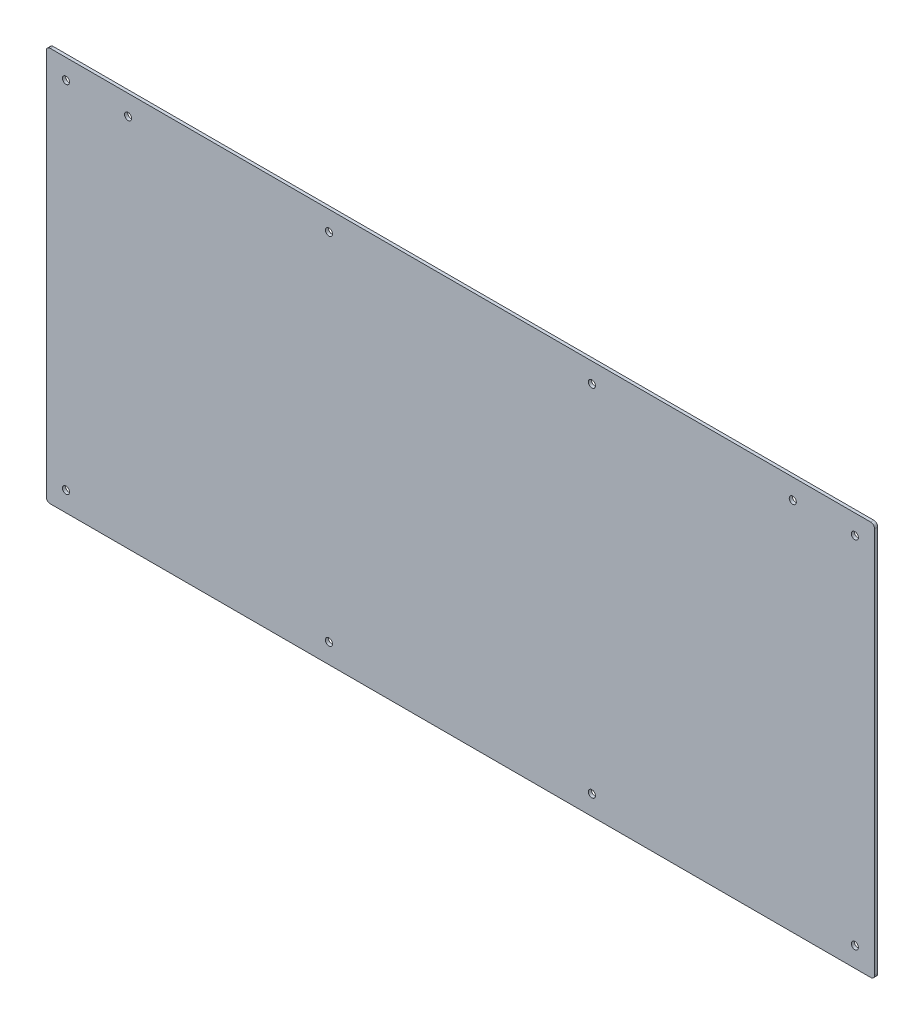
from build123d import *

# Parameters (mm, degrees)
SKETCH1_W            = 420
SKETCH1_H            = 200
BASE_FLANGE1_DEPTH   = 1.588
BREAK_CORNER1_START  = -1.588
BREAK_CORNER1_DEPTH  = 1.588
M3_CLEARANCE_HOLE1_D = 3.6
LPATTERN1_COUNT      = 4
LPATTERN1_PITCH      = 133.333333333
MIRROR1_COPY_1_D     = 3.6
MIRROR1_COPY_2_D     = 3.6
MIRROR1_COPY_3_D     = 3.6
M3_CLEARANCE_HOLE2_D = 3.6


# Read off the part's stored shape, not the designer's step: Break-Corner1
# Sheet-metal steps are written as plain solids
with BuildPart() as part:
    # Sketch1 → Base-Flange1 (new body)
    with BuildSketch(Plane.XY):
        Rectangle(SKETCH1_W, SKETCH1_H)
    extrude(amount=-BASE_FLANGE1_DEPTH)

    # Break-Corner1 outline → Break-Corner1 (cut)
    with BuildSketch(Plane.XY.offset(BREAK_CORNER1_START)):
        with BuildLine():
            ThreePointArc((-208, -100), (-209.414213562, -99.414213562), (-210, -98))
            Line((-210, -98), (-210, -100))
            Line((-210, -100), (-208, -100))
        make_face()
        with BuildLine():
            Line((-210, 100), (-210, 98))
            ThreePointArc((-210, 98), (-209.414213562, 99.414213562), (-208, 100))
            Line((-208, 100), (-210, 100))
        make_face()
        with BuildLine():
            ThreePointArc((210, -98), (209.414213562, -99.414213562), (208, -100))
            Line((208, -100), (210, -100))
            Line((210, -100), (210, -98))
        make_face()
        with BuildLine():
            Line((210, 100), (208, 100))
            ThreePointArc((208, 100), (209.414213562, 99.414213562), (210, 98))
            Line((210, 98), (210, 100))
        make_face()
    extrude(amount=BREAK_CORNER1_DEPTH, mode=Mode.SUBTRACT)

    # M3 Clearance Hole1 (through all)
    with Locations(Plane.XY):
        with Locations((-200, 90)):
            m3_clearance_hole1 = Hole(M3_CLEARANCE_HOLE1_D / 2)

    # LPattern1: M3 Clearance Hole1 ×4
    with Locations(*[(i * LPATTERN1_PITCH, 0, 0) for i in range(1, LPATTERN1_COUNT)]):
        add(m3_clearance_hole1, mode=Mode.SUBTRACT)

    # Mirror1: M3 Clearance Hole1 across plane
    add(m3_clearance_hole1.mirror(Plane.ZX), mode=Mode.SUBTRACT)

    # Mirror1 copy 1 (through all)
    with Locations(Plane(origin=(133.333333333, 0, 0), x_dir=(1, 0, 0), z_dir=(0, 0, 1))):
        with Locations((-200, -90)):
            Hole(MIRROR1_COPY_1_D / 2)

    # Mirror1 copy 2 (through all)
    with Locations(Plane(origin=(266.666666667, 0, 0), x_dir=(1, 0, 0), z_dir=(0, 0, 1))):
        with Locations((-200, -90)):
            Hole(MIRROR1_COPY_2_D / 2)

    # Mirror1 copy 3 (through all)
    with Locations(Plane(origin=(400, 0, 0), x_dir=(1, 0, 0), z_dir=(0, 0, 1))):
        with Locations((-200, -90)):
            Hole(MIRROR1_COPY_3_D / 2)

    # M3 Clearance Hole2 (through all)
    with Locations(Plane.XY):
        with Locations((-168.522812918, 89.845354769)):
            m3_clearance_hole2 = Hole(M3_CLEARANCE_HOLE2_D / 2)

    # Mirror3: M3 Clearance Hole2 across plane
    add(m3_clearance_hole2.mirror(Plane(origin=(0, 0, 0), x_dir=(0, 0, 1), z_dir=(1, 0, 0))), mode=Mode.SUBTRACT)


solid = part.part
